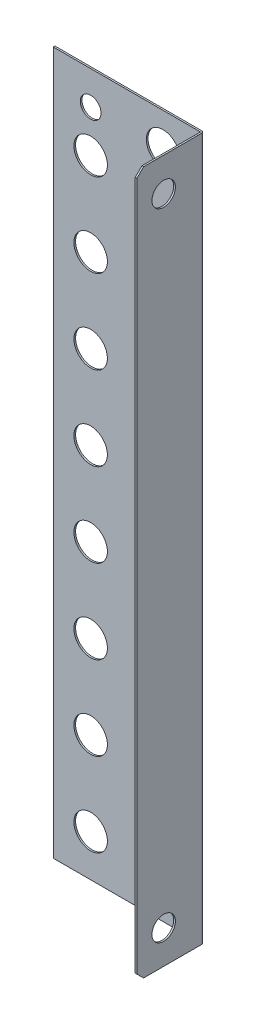
from build123d import *

# Parameters (mm, degrees)
SKETCH1_W                    = 44
SKETCH1_H                    = 210
BASE_FLANGE1_DEPTH           = 0.5
SKETCH6_R                    = 5
CUT_EXTRUDE1_DEPTH           = 108.281172626
LPATTERN1_COUNT              = 8
LPATTERN1_PITCH              = 25
EDGE_FLANGE1_STRIP_W         = 2.1
EDGE_FLANGE1_STRIP_H         = 0.5
EDGE_FLANGE1_STRIP_CUT_DEPTH = 210
EDGE_FLANGE1_DEPTH           = 210
F_7_0_7_DIAMETER_HOLE1_D     = 7
F_7_0_7_DIAMETER_HOLE1_DEPTH = 60
F_7_0_7_DIAMETER_HOLE1_TIP   = 2.103012167
BREAK_CORNER1_START          = 22
BREAK_CORNER1_DEPTH          = 0.5
CUT_EXTRUDE2_DEPTH           = 110.139818581
CUT_EXTRUDE2_DEPTH_BACK      = 110.139818581
SKETCH13_R                   = 3.1


# Read off the part's stored shape, not the designer's step: Break-Corner1
# Sheet-metal steps are written as plain solids
with BuildPart() as part:
    # Sketch1 → Base-Flange1 (new body)
    with BuildSketch(Plane.XY):
        Rectangle(SKETCH1_W, SKETCH1_H)
    extrude(amount=-BASE_FLANGE1_DEPTH)

    # Sketch6 → Cut-Extrude1 (cut, symmetric)
    with BuildSketch(Plane.XY):
        with Locations((10.825317547, 95)):
            Circle(SKETCH6_R)
        with Locations((-10.825317547, 82.5)):
            Circle(SKETCH6_R)
    cut_extrude1 = extrude(amount=CUT_EXTRUDE1_DEPTH, both=True, mode=Mode.SUBTRACT)

    # LPattern1: Cut-Extrude1 ×8
    with Locations(*[(0, -i * LPATTERN1_PITCH, 0) for i in range(1, LPATTERN1_COUNT)]):
        add(cut_extrude1, mode=Mode.SUBTRACT)

    # Edge-Flange1 strip (across the edge) → Edge-Flange1 strip cut (cut)
    with BuildSketch(Plane(origin=(22, -105, 0), x_dir=(-1, 0, 0), z_dir=(0, 1, 0))):
        with Locations((-1, -0.25)):
            Rectangle(EDGE_FLANGE1_STRIP_W, EDGE_FLANGE1_STRIP_H)
    extrude(amount=EDGE_FLANGE1_STRIP_CUT_DEPTH, mode=Mode.SUBTRACT)

    # Edge-Flange1 section (across the edge) → Edge-Flange1 (add)
    with BuildSketch(Plane(origin=(22, -105, 0), x_dir=(-1, 0, 0), z_dir=(0, 1, 0))):
        with BuildLine():
            Line((-0.5, 0.05), (-0.5, 19.5))
            Line((-0.5, 19.5), (0, 19.5))
            Line((0, 19.5), (0, 0.05))
            ThreePointArc((0, 0.05), (0.014644661, 0.014644661), (0.05, 0))
            Line((0.05, 0), (0.05, -0.5))
            ThreePointArc((0.05, -0.5), (-0.33890873, -0.33890873), (-0.5, 0.05))
        make_face()
    extrude(amount=EDGE_FLANGE1_DEPTH)

    # Ø7.0 (7) Diameter Hole1
    with Locations(Plane(origin=(22.5, 0, 0), x_dir=(0, 0, -1), z_dir=(1, 0, 0))):
        with Locations((-11.5, 95), (-11.5, -95)):
            Hole(F_7_0_7_DIAMETER_HOLE1_D / 2, depth=F_7_0_7_DIAMETER_HOLE1_DEPTH)
            with Locations((0, 0, -(F_7_0_7_DIAMETER_HOLE1_DEPTH + F_7_0_7_DIAMETER_HOLE1_TIP / 2))):  # 118° drill point
                Cone(0, F_7_0_7_DIAMETER_HOLE1_D / 2, F_7_0_7_DIAMETER_HOLE1_TIP, mode=Mode.SUBTRACT)

    # Break-Corner1 outline → Break-Corner1 (cut)
    with BuildSketch(Plane.YZ.offset(BREAK_CORNER1_START)):
        Polygon((-105, 19.5), (-105, 17.5), (-103, 19.5), align=None)
        Polygon((105, 19.5), (103, 19.5), (105, 17.5), align=None)
    extrude(amount=BREAK_CORNER1_DEPTH, mode=Mode.SUBTRACT)

    # Sketch13 → Cut-Extrude2 (cut, two sides: drawn at the far end of the back side and taken through both)
    with BuildSketch(Plane.XY.offset(-CUT_EXTRUDE2_DEPTH_BACK)):
        with Locations((-10.825317547, 95)):
            Circle(SKETCH13_R)
        with Locations((10.825317547, -92.5)):
            Circle(SKETCH13_R)
    extrude(amount=CUT_EXTRUDE2_DEPTH + CUT_EXTRUDE2_DEPTH_BACK, mode=Mode.SUBTRACT)


solid = part.part
